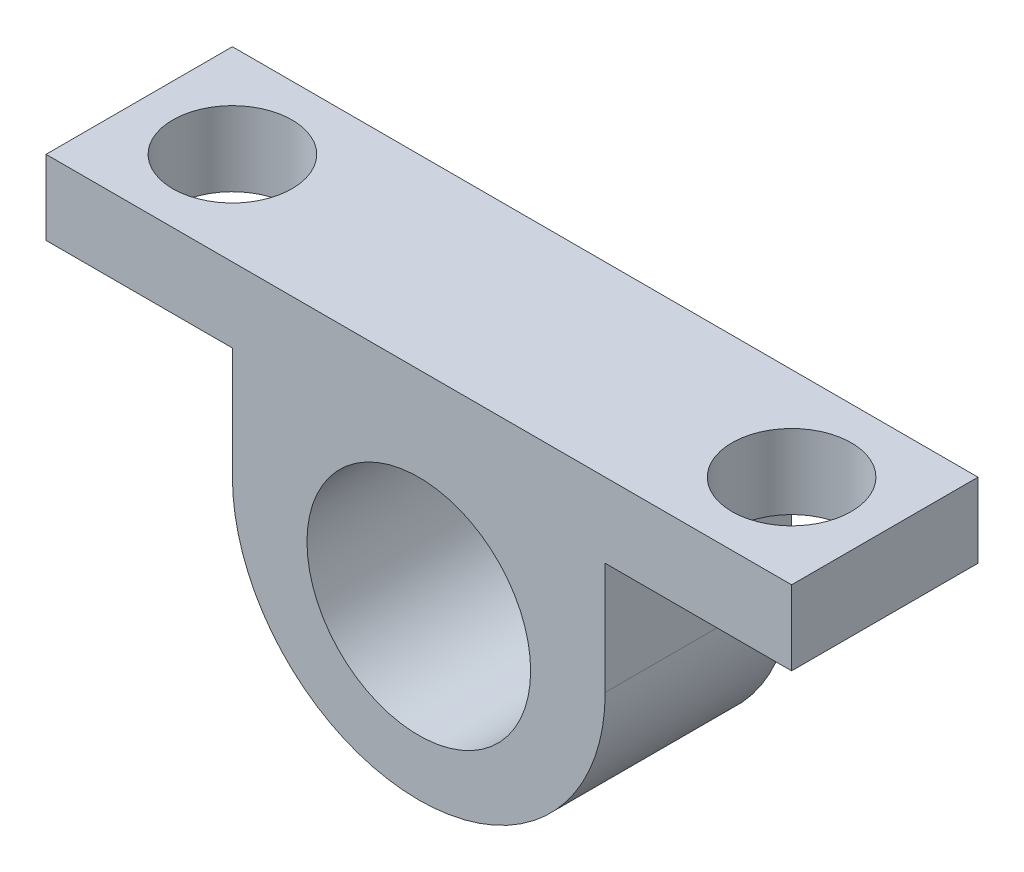
from build123d import *

# Parameters (mm, degrees)
SKETCH1_W           = 10
SKETCH1_H           = 5
BOSS_EXTRUDE1_DEPTH = 10
CUT_EXTRUDE1_REACH  = 14.247
SKETCH2_R           = 3
SKETCH3_W           = 20
SKETCH3_H           = 5
SKETCH3_R           = 1.6
BOSS_EXTRUDE2_DEPTH = 2
FILLET1_R           = 5


with BuildPart() as part:
    # Sketch1 → Boss-Extrude1 (new body)
    with BuildSketch(Plane(origin=(0, 0, 0), x_dir=(1, 0, 0), z_dir=(0, 1, 0))):
        Rectangle(SKETCH1_W, SKETCH1_H)
    extrude(amount=-BOSS_EXTRUDE1_DEPTH)

    # Sketch2 → Cut-Extrude1 (cut, up to next)
    with BuildSketch(Plane(origin=(0, 0, -2.5), x_dir=(-1, 0, 0), z_dir=(0, 0, -1)), mode=Mode.PRIVATE) as cut_extrude1_sk1:
        with Locations((0, -5.5)):
            Circle(SKETCH2_R)
    cut_extrude1_tool1 = extrude(cut_extrude1_sk1.sketch, amount=-CUT_EXTRUDE1_REACH, mode=Mode.PRIVATE) & part.part
    add(cut_extrude1_tool1.solids().sort_by_distance((0, -5.5, -2.5))[0], mode=Mode.SUBTRACT)

    # Sketch3 → Boss-Extrude2 (add)
    with BuildSketch(Plane(origin=(0, 0, 0), x_dir=(1, 0, 0), z_dir=(0, 1, 0))):
        Rectangle(SKETCH3_W, SKETCH3_H)
        with Locations(Location((-7.5, 0, 0), (0, 0, 270))):
            Circle(SKETCH3_R, mode=Mode.SUBTRACT)
        with Locations(Location((7.5, 0, 0), (0, 0, 270))):
            Circle(SKETCH3_R, mode=Mode.SUBTRACT)
    extrude(amount=-BOSS_EXTRUDE2_DEPTH)

    # Fillet1
    fillet1_edges = [part.edges().sort_by_distance(p)[0] for p in [
        (-5, -10, 0),
        (5, -10, 0),
    ]]
    fillet(fillet1_edges, radius=FILLET1_R - 0.0001)  # a hair under: the kernel refuses the full size


solid = part.part
